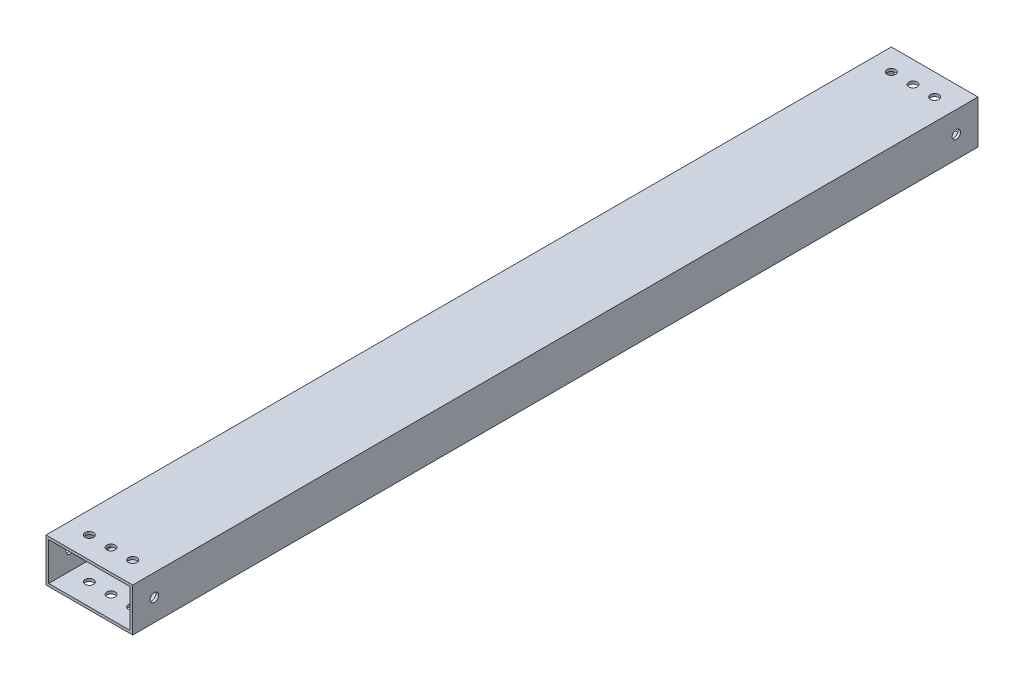
from build123d import *

# Parameters (mm, degrees)
SKETCH1_W           = 50.8
SKETCH1_H           = 25.4
SKETCH1_W_2         = 47.625
SKETCH1_H_2         = 22.225
BOSS_EXTRUDE1_DEPTH = 247.65
SKETCH2_R           = 2.4892
CUT_EXTRUDE1_DEPTH  = 251.24156829
SKETCH3_R           = 2.4892
CUT_EXTRUDE2_DEPTH  = 254.125369136


with BuildPart() as part:
    # Sketch1 → Boss-Extrude1 (new, symmetric)
    with BuildSketch(Plane.XY):
        Rectangle(SKETCH1_W, SKETCH1_H)
        Rectangle(SKETCH1_W_2, SKETCH1_H_2, mode=Mode.SUBTRACT)
    extrude(amount=BOSS_EXTRUDE1_DEPTH, both=True)

    # Sketch2 → Cut-Extrude1 (cut, through all)
    with BuildSketch(Plane(origin=(0, 12.7, 0), x_dir=(1, 0, 0), z_dir=(0, 1, 0))):
        with Locations((-12.7, 234.95)):
            Circle(SKETCH2_R)
        with Locations((0, 234.95)):
            Circle(SKETCH2_R)
        with Locations((12.7, 234.95)):
            Circle(SKETCH2_R)
        with Locations((12.7, -234.95)):
            Circle(SKETCH2_R)
        with Locations((0, -234.95)):
            Circle(SKETCH2_R)
        with Locations((-12.7, -234.95)):
            Circle(SKETCH2_R)
    extrude(amount=-CUT_EXTRUDE1_DEPTH, mode=Mode.SUBTRACT)

    # Sketch3 → Cut-Extrude2 (cut, through all)
    with BuildSketch(Plane(origin=(25.4, 0, 0), x_dir=(0, 0, -1), z_dir=(1, 0, 0))):
        with Locations((234.95, 0)):
            Circle(SKETCH3_R)
        with Locations((-234.95, 0)):
            Circle(SKETCH3_R)
    extrude(amount=-CUT_EXTRUDE2_DEPTH, mode=Mode.SUBTRACT)


solid = part.part
